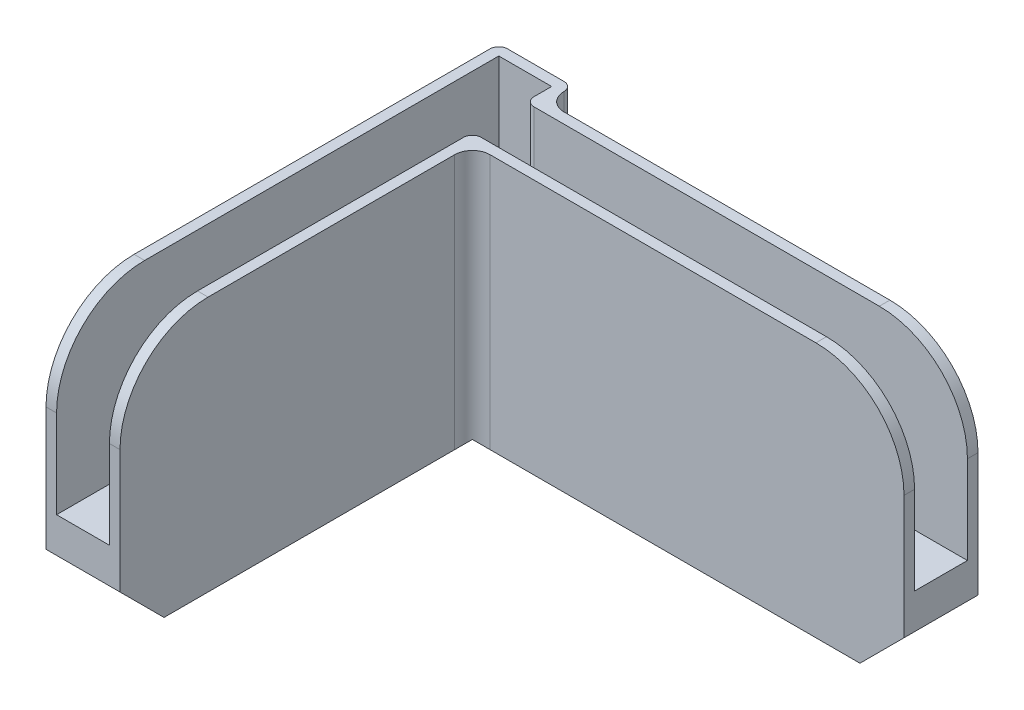
from build123d import *

# Parameters (mm, degrees)
EXTRUDE_1_DEPTH     = 20
EXTRUDE_1_2_DEPTH   = 10
CHAMFER_1_SIZE      = 6
CHAMFER_2_SIZE      = 1
CUT_EXTRUDE_1_REACH = 74.497
SKETCH_3_W          = 6
SKETCH_3_H          = 20
CUT_EXTRUDE_2_REACH = 79.965
SKETCH_4_W          = 6
SKETCH_4_H          = 20
FILLET_1_R          = 10
FILLET_2_R          = 2
FILLET_3_R          = 1


with BuildPart() as part:
    # Эскиз1 → Extrude 1 (new body)
    with BuildSketch(Plane(origin=(0, 0, 0), x_dir=(1, 0, 0), z_dir=(0, 1, 0))):
        Polygon((1.2, -1.2), (-47.8, -1.2), (-47.8, -41.2), (-56.2, -41.2), (-56.2, 10.2), (-47.8, 10.2), (-47.8, 7.2), (1.2, 7.2), align=None)
        Polygon((0, 0), (-49, 0), (-49, -40), (-55, -40), (-55, 9), (-49, 9), (-49, 6), (0, 6), align=None, mode=Mode.SUBTRACT)
    extrude(amount=EXTRUDE_1_DEPTH)

    # Эскиз2 → Extrude 1 2 (add)
    with BuildSketch(Plane.XZ):
        Polygon((-56.2, 41.2), (-47.8, 41.2), (-47.8, 1.2), (1.2, 1.2), (1.2, -7.2), (-47.8, -7.2), (-47.8, -10.2), (-56.2, -10.2), align=None)
    extrude(amount=EXTRUDE_1_2_DEPTH)

    # Фаска1
    chamfer_1_edges = [part.edges().sort_by_distance(p)[0] for p in [
        (1.2, -10, -3),
    ]]
    chamfer(chamfer_1_edges, length=CHAMFER_1_SIZE)
    chamfer_1_2_edges = [part.edges().sort_by_distance(p)[0] for p in [
        (-52, -10, -10.2),
    ]]
    chamfer(chamfer_1_2_edges, length=CHAMFER_1_SIZE)
    chamfer_1_3_edges = [part.edges().sort_by_distance(p)[0] for p in [
        (-52, -10, 41.2),
    ]]
    chamfer(chamfer_1_3_edges, length=CHAMFER_1_SIZE)

    # Фаска2
    chamfer_2_edges = [part.edges().sort_by_distance(p)[0] for p in [
        (-47.8, -10, 18.2),
        (-56.2, -10, 15.5),
        (-26.3, -10, 1.2),
    ]]
    chamfer(chamfer_2_edges, length=CHAMFER_2_SIZE)

    # Эскиз3 → Вырез-Вытянуть1 (cut, up to next)
    with BuildSketch(Plane.ZY, mode=Mode.PRIVATE) as cut_extrude_1_sk1:
        with Locations((-3, 10)):
            Rectangle(SKETCH_3_W, SKETCH_3_H)
    cut_extrude_1_tool1 = extrude(cut_extrude_1_sk1.sketch, amount=-CUT_EXTRUDE_1_REACH, mode=Mode.PRIVATE) & part.part
    add(cut_extrude_1_tool1.solids().sort_by_distance((0, 10, -3))[0], mode=Mode.SUBTRACT)

    # Эскиз4 → Вырез-Вытянуть2 (cut, up to next)
    with BuildSketch(Plane(origin=(0, 0, 40), x_dir=(-1, 0, 0), z_dir=(0, 0, -1)), mode=Mode.PRIVATE) as cut_extrude_2_sk1:
        with Locations((52, 10)):
            Rectangle(SKETCH_4_W, SKETCH_4_H)
    cut_extrude_2_tool1 = extrude(cut_extrude_2_sk1.sketch, amount=-CUT_EXTRUDE_2_REACH, mode=Mode.PRIVATE) & part.part
    add(cut_extrude_2_tool1.solids().sort_by_distance((-52, 10, 40))[0], mode=Mode.SUBTRACT)

    # Скругление1
    fillet_1_edges = [part.edges().sort_by_distance(p)[0] for p in [
        (1.2, 20, -6.6),
        (-48.4, 20, 41.2),
        (-55.6, 20, 41.2),
        (1.2, 20, 0.6),
    ]]
    fillet(fillet_1_edges, radius=FILLET_1_R)

    # Скругление2
    fillet_2_edges = [part.edges().sort_by_distance(p)[0] for p in [
        (-47.8, 5.5, 1.2),
        (-47.8, 6.5, -7.2),
    ]]
    fillet(fillet_2_edges, radius=FILLET_2_R)

    # Скругление3
    fillet_3_edges = [part.edges().sort_by_distance(p)[0] for p in [
        (-56.2, 8, -10.2),
        (-47.8, 8, -10.2),
        (-49, 10, -6),
        (-49, 10, 0),
    ]]
    fillet(fillet_3_edges, radius=FILLET_3_R - 0.0001)  # a hair under: the kernel refuses the full size


solid = part.part
